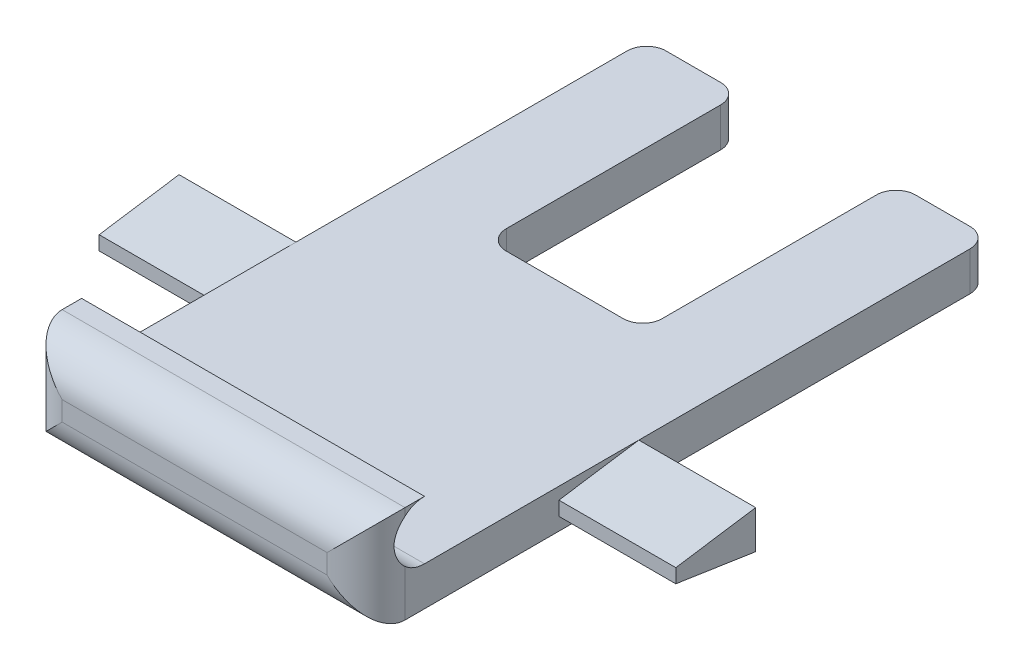
from build123d import *

# Parameters (mm, degrees)
SKETCH1_W           = 88
SKETCH1_H           = 160
BOSS_EXTRUDE1_DEPTH = 10
SKETCH2_W           = 88
SKETCH2_H           = 15
BOSS_EXTRUDE2_DEPTH = 15
SKETCH3_R           = 7.5
CUT_EXTRUDE1_DEPTH  = 88
FILLET1_R           = 10
SKETCH4_W           = 40
SKETCH4_H           = 65
CUT_EXTRUDE2_DEPTH  = 10
FILLET2_R           = 5
FILLET3_R           = 5
BOSS_EXTRUDE4_DEPTH = 30


with BuildPart() as part:
    # Sketch1 → Boss-Extrude1 (new body)
    with BuildSketch(Plane(origin=(0, 0, 0), x_dir=(1, 0, 0), z_dir=(0, 1, 0))):
        with Locations((44, 80)):
            Rectangle(SKETCH1_W, SKETCH1_H)
    extrude(amount=BOSS_EXTRUDE1_DEPTH)

    # Sketch2 → Boss-Extrude2 (add)
    with BuildSketch(Plane(origin=(0, 10, 0), x_dir=(1, 0, 0), z_dir=(0, 1, 0))):
        with Locations((44, 7.5)):
            Rectangle(SKETCH2_W, SKETCH2_H)
    extrude(amount=BOSS_EXTRUDE2_DEPTH)

    # Sketch3 → Cut-Extrude1 (cut)
    with BuildSketch(Plane(origin=(88, 0, 0), x_dir=(0, 0, -1), z_dir=(1, 0, 0))):
        with Locations((15, 17.5)):
            Circle(SKETCH3_R)
    extrude(amount=-CUT_EXTRUDE1_DEPTH, mode=Mode.SUBTRACT)

    # Fillet1
    # the kernel refuses this fillet: 10 mm, written as the material it takes off along each edge
    with BuildSketch(Plane(origin=(-25, 25, 0), x_dir=(0, -1, 0), z_dir=(1, 0, 0))) as fillet1_piece_1:
        with BuildLine():
            CenterArc((FILLET1_R, FILLET1_R), FILLET1_R, 180, 90)
            Line((0, FILLET1_R), (0, 0))
            Line((0, 0), (FILLET1_R, 0))
        make_face()
    extrude(amount=138, mode=Mode.SUBTRACT)
    with BuildSketch(Plane(origin=(-25, 0, 0), x_dir=(0, 1, 0), z_dir=(1, 0, 0))) as fillet1_piece_2:
        with BuildLine():
            CenterArc((FILLET1_R, -FILLET1_R), FILLET1_R, 90, 90)
            Line((0, -FILLET1_R), (0, 0))
            Line((0, 0), (FILLET1_R, 0))
        make_face()
    extrude(amount=138, mode=Mode.SUBTRACT)
    with BuildSketch(Plane(origin=(88, -25, 0), x_dir=(-1, 0, 0), z_dir=(0, 1, 0)), Plane(origin=(0, 50, 0), x_dir=(1, 0, 0), z_dir=(0, -1, 0))) as fillet1_piece_3:
        with BuildLine():
            CenterArc((FILLET1_R, -FILLET1_R), FILLET1_R, 90, 90)
            Line((0, -FILLET1_R), (0, 0))
            Line((0, 0), (FILLET1_R, 0))
        make_face()
    extrude(amount=75, mode=Mode.SUBTRACT)

    # Sketch4 → Cut-Extrude2 (cut)
    with BuildSketch(Plane(origin=(0, 10, 0), x_dir=(1, 0, 0), z_dir=(0, 1, 0))):
        with Locations((44, 127.5)):
            Rectangle(SKETCH4_W, SKETCH4_H)
    extrude(amount=-CUT_EXTRUDE2_DEPTH, mode=Mode.SUBTRACT)

    # Fillet2
    fillet2_edges = [part.edges().sort_by_distance(p)[0] for p in [
        (64, 5, -95),
        (24, 5, -95),
        (24, 5, -160),
        (64, 5, -160),
    ]]
    fillet(fillet2_edges, radius=FILLET2_R)

    # Fillet3
    fillet3_edges = [part.edges().sort_by_distance(p)[0] for p in [
        (0, 5, -160),
        (88, 5, -160),
    ]]
    fillet(fillet3_edges, radius=FILLET3_R)

    # Sketch5 → Boss-Extrude4 (add)
    with BuildSketch(Plane.ZY):
        Polygon((-70, 10), (-70, 0.2), (-49.5, 3.3), (-49.5, 6.9), align=None)
    boss_extrude4 = extrude(amount=BOSS_EXTRUDE4_DEPTH)

    # Mirror1: Boss-Extrude4 across plane
    add(boss_extrude4.mirror(Plane(origin=(44, 0, 0), x_dir=(0, 0, 1), z_dir=(1, 0, 0))))


solid = part.part
